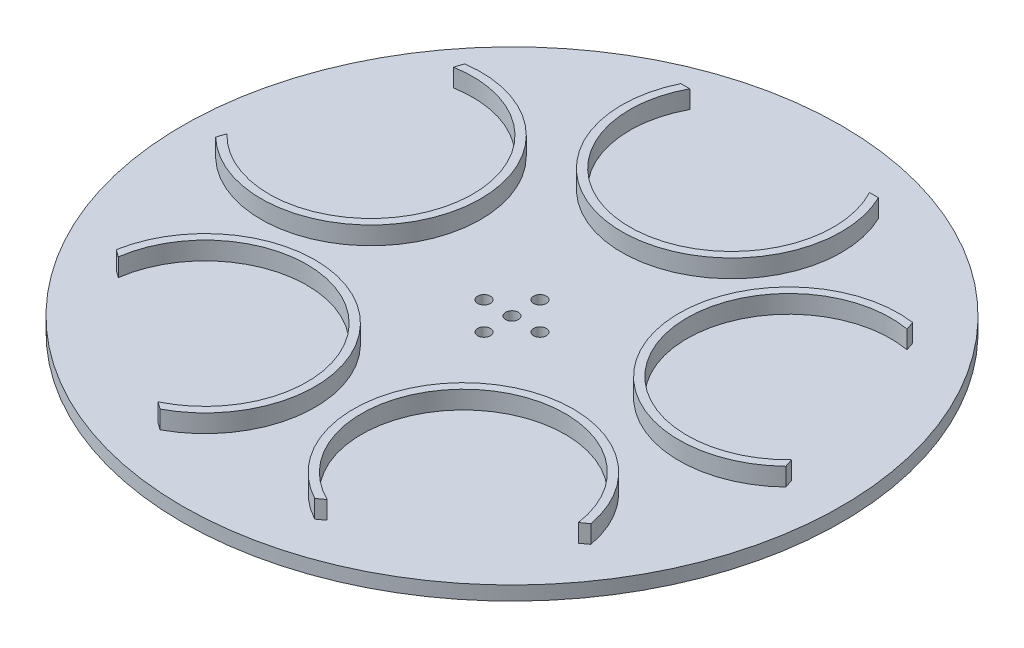
from build123d import *

# Parameters (mm, degrees)
SKETCH_2_R      = 82.5
SKETCH_2_R_2    = 1.6
EXTRUDE_1_DEPTH = 3.5
EXTRUDE_2_DEPTH = 8


with BuildPart() as part:
    # 草图2 → 凸台-拉伸1 (new body)
    with BuildSketch(Plane(origin=(0, 0, 0), x_dir=(1, 0, 0), z_dir=(0, 1, 0))):
        Circle(SKETCH_2_R)
        with Locations((0, -7)):
            Circle(SKETCH_2_R_2, mode=Mode.SUBTRACT)
        with Locations((-7, 0)):
            Circle(SKETCH_2_R_2, mode=Mode.SUBTRACT)
        Circle(SKETCH_2_R_2, mode=Mode.SUBTRACT)
        with Locations((7, 0)):
            Circle(SKETCH_2_R_2, mode=Mode.SUBTRACT)
        with Locations((0, 7)):
            Circle(SKETCH_2_R_2, mode=Mode.SUBTRACT)
    extrude(amount=EXTRUDE_1_DEPTH)

    # 草图2<3> → 凸台-拉伸2 (add)
    with BuildSketch(Plane(origin=(0, 0, 0), x_dir=(1, 0, 0), z_dir=(0, 1, 0))):
        with BuildLine():
            ThreePointArc((22.5, 67), (0, 29.5), (-22.5, 67))
            Line((-22.5, 67), (-24.743686063, 67))
            ThreePointArc((-24.743686063, 67), (0, 27.5), (24.743686063, 67))
            Line((24.743686063, 67), (22.5, 67))
        make_face()
        with BuildLine():
            ThreePointArc((70.673668965, -0.694632994), (28.056167231, 9.116001334), (56.767904218, 42.10291024))
            Line((56.767904218, 42.10291024), (56.074567095, 44.236782491))
            ThreePointArc((56.074567095, 44.236782491), (26.154054198, 8.497967345), (71.367006089, -2.828505245))
            Line((71.367006089, -2.828505245), (70.673668965, -0.694632994))
        make_face()
        with BuildLine():
            ThreePointArc((21.17872953, -67.4293068), (17.339664943, -23.866001334), (57.584494277, -40.978970447))
            Line((57.584494277, -40.978970447), (59.399674432, -39.660164868))
            ThreePointArc((59.399674432, -39.660164868), (16.164094438, -22.247967345), (19.363549375, -68.748112378))
            Line((19.363549375, -68.748112378), (21.17872953, -67.4293068))
        make_face()
        with BuildLine():
            ThreePointArc((-57.584494277, -40.978970447), (-17.339664943, -23.866001334), (-21.17872953, -67.4293068))
            Line((-21.17872953, -67.4293068), (-19.363549375, -68.748112378))
            ThreePointArc((-19.363549375, -68.748112378), (-16.164094438, -22.247967345), (-59.399674432, -39.660164868))
            Line((-59.399674432, -39.660164868), (-57.584494277, -40.978970447))
        make_face()
        with BuildLine():
            ThreePointArc((-56.767904218, 42.10291024), (-28.056167231, 9.116001334), (-70.673668965, -0.694632994))
            Line((-70.673668965, -0.694632994), (-71.367006089, -2.828505245))
            ThreePointArc((-71.367006089, -2.828505245), (-26.154054198, 8.497967345), (-56.074567095, 44.236782491))
            Line((-56.074567095, 44.236782491), (-56.767904218, 42.10291024))
        make_face()
    extrude(amount=EXTRUDE_2_DEPTH)


solid = part.part
